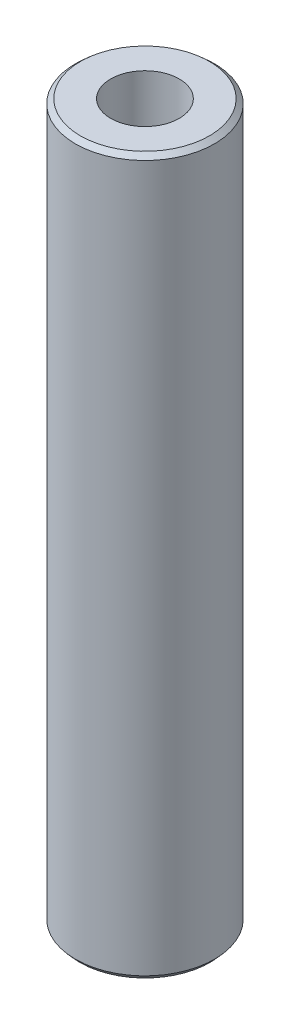
from build123d import *
from OCP.BRepFilletAPI import BRepFilletAPI_MakeChamfer

# Parameters (mm, degrees)
SKETCH1_R           = 37.5
BOSS_EXTRUDE1_DEPTH = 386.096508248
SKETCH2_R           = 18.479870695
CUT_EXTRUDE1_DEPTH  = 390.721713126
CHAMFER1_SIZE       = 2.388456165
CHAMFER1_SIZE2      = 2.701513374


with BuildPart() as part:
    # Sketch1 → Boss-Extrude1 (new body)
    with BuildSketch(Plane(origin=(0, 0, 0), x_dir=(1, 0, 0), z_dir=(0, 1, 0))):
        Circle(SKETCH1_R)
    extrude(amount=BOSS_EXTRUDE1_DEPTH)

    # Sketch2 → Cut-Extrude1 (cut, through all)
    with BuildSketch(Plane(origin=(0, 0, 0), x_dir=(1, 0, 0), z_dir=(0, 1, 0))):
        Circle(SKETCH2_R)
    extrude(amount=CUT_EXTRUDE1_DEPTH, mode=Mode.SUBTRACT)

    # Chamfer1: one chamfer whose edges measure the first distance from different faces: ONE call of the kernel's chamfer builder (chamfer() names one face for all edges)
    chamfer1_edges_1 = [part.edges().sort_by_distance(p)[0] for p in [
        (-37.5, 386.096508248, 0),
    ]]
    chamfer1_side_1 = [part.faces().sort_by_distance(p)[0] for p in [
        (-37.5, 193.048254124, 0),
    ]]
    chamfer1_edges_2 = [part.edges().sort_by_distance(p)[0] for p in [
        (-37.5, 0, 0),
    ]]
    chamfer1_side_2 = [part.faces().sort_by_distance(p)[0] for p in [
        (-36.439339828, 0, 0),
    ]]
    chamfer1 = BRepFilletAPI_MakeChamfer(part.part.solid().wrapped)
    for e in chamfer1_edges_1:
        chamfer1.Add(CHAMFER1_SIZE, CHAMFER1_SIZE2, e.wrapped, chamfer1_side_1[0].wrapped)  # the first distance lies on this face
    for e in chamfer1_edges_2:
        chamfer1.Add(CHAMFER1_SIZE, CHAMFER1_SIZE2, e.wrapped, chamfer1_side_2[0].wrapped)  # the first distance lies on this face
    add(Compound.cast(chamfer1.Shape()), mode=Mode.REPLACE)


solid = part.part
